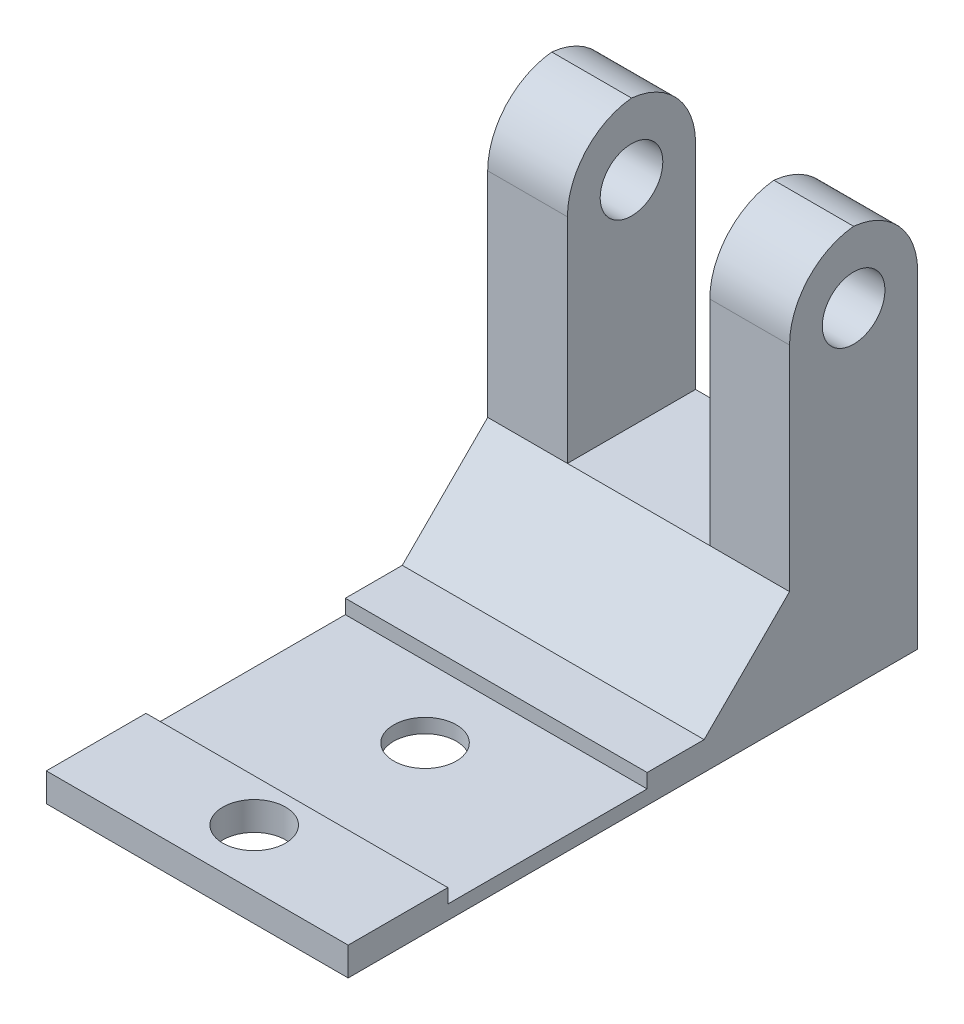
from build123d import *

# Parameters (mm, degrees)
SKETCH1_R           = 1.1
BOSS_EXTRUDE1_DEPTH = 1
SKETCH2_W           = 2.8
SKETCH2_H           = 5
BOSS_EXTRUDE2_DEPTH = 8
SKETCH4_W           = 2.8
SKETCH4_H           = 9
BOSS_EXTRUDE3_DEPTH = 3
SKETCH5_R           = 1.1
CUT_EXTRUDE2_DEPTH  = 100
SKETCH6_W           = 2.8
SKETCH6_H           = 8
BOSS_EXTRUDE4_DEPTH = 1
SKETCH7_W           = 3.5
SKETCH7_H           = 9
CUT_EXTRUDE3_DEPTH  = 100
CHAMFER2_SIZE       = 3
SKETCH8_W           = 10.6
SKETCH8_H           = 3
CUT_EXTRUDE4_DEPTH  = 10
BOSS_EXTRUDE5_DEPTH = 7.8
SKETCH10_W          = 10.6
SKETCH10_H          = 7
CUT_EXTRUDE5_DEPTH  = 0.5
SKETCH11_W          = 2.8
SKETCH11_H          = 4.5
BOSS_EXTRUDE6_DEPTH = 4
SKETCH12_R          = 1.1
BOSS_EXTRUDE7_DEPTH = 10.6
SKETCH13_W          = 5
SKETCH13_H          = 4.5
CUT_EXTRUDE6_DEPTH  = 10
SKETCH14_R          = 1.1
CUT_EXTRUDE7_DEPTH  = 20
FILLET1_R           = 2.5


with BuildPart() as part:
    # Sketch1 → Boss-Extrude1 (new body)
    with BuildSketch(Plane(origin=(0, 0, 0), x_dir=(1, 0, 0), z_dir=(0, 1, 0))):
        Polygon((-14.28, 13.79), (-14.28, -6.21), (-3.68, -6.21), (-3.68, 13.79), (-6.48, 13.79), (-6.48, 8.79), (-11.48, 8.79), (-11.48, 13.79), align=None)
        with Locations(Location((-8.98, 4.79, 0), (0, 0, 270))):
            Circle(SKETCH1_R, mode=Mode.SUBTRACT)
        with Locations(Location((-8.98, -1.21, 0), (0, 0, 270))):
            Circle(SKETCH1_R, mode=Mode.SUBTRACT)
    extrude(amount=BOSS_EXTRUDE1_DEPTH)

    # Sketch2 → Boss-Extrude2 (add)
    with BuildSketch(Plane(origin=(0, 1, 0), x_dir=(1, 0, 0), z_dir=(0, 1, 0))):
        with Locations((-12.88, 11.29)):
            Rectangle(SKETCH2_W, SKETCH2_H)
        with Locations((-5.08, 11.29)):
            Rectangle(SKETCH2_W, SKETCH2_H)
    extrude(amount=BOSS_EXTRUDE2_DEPTH)

    # Sketch4 → Boss-Extrude3 (add)
    with BuildSketch(Plane(origin=(0, 0, -13.79), x_dir=(-1, 0, 0), z_dir=(0, 0, -1))):
        with Locations((5.08, 4.5)):
            Rectangle(SKETCH4_W, SKETCH4_H)
        with Locations((12.88, 4.5)):
            Rectangle(SKETCH4_W, SKETCH4_H)
    extrude(amount=BOSS_EXTRUDE3_DEPTH)

    # Sketch5 → Cut-Extrude2 (cut)
    with BuildSketch(Plane(origin=(-3.68, 0, 0), x_dir=(0, 0, -1), z_dir=(1, 0, 0))):
        with Locations((14.29, 7.5)):
            Circle(SKETCH5_R)
    extrude(amount=-CUT_EXTRUDE2_DEPTH, mode=Mode.SUBTRACT)

    # Sketch6 → Boss-Extrude4 (add)
    with BuildSketch(Plane(origin=(0, 9, 0), x_dir=(1, 0, 0), z_dir=(0, 1, 0))):
        with Locations((-12.88, 12.79)):
            Rectangle(SKETCH6_W, SKETCH6_H)
        with Locations((-5.08, 12.79)):
            Rectangle(SKETCH6_W, SKETCH6_H)
    extrude(amount=BOSS_EXTRUDE4_DEPTH)

    # Sketch7 → Cut-Extrude3 (cut)
    with BuildSketch(Plane(origin=(-3.68, 0, 0), x_dir=(0, 0, -1), z_dir=(1, 0, 0))):
        with Locations((10.54, 5.5)):
            Rectangle(SKETCH7_W, SKETCH7_H)
    extrude(amount=-CUT_EXTRUDE3_DEPTH, mode=Mode.SUBTRACT)

    # Chamfer2
    chamfer2_edges = [part.edges().sort_by_distance(p)[0] for p in [
        (-5.08, 1, -12.29),
        (-12.88, 1, -12.29),
    ]]
    chamfer(chamfer2_edges, length=CHAMFER2_SIZE)

    # Sketch8 → Cut-Extrude4 (cut)
    with BuildSketch(Plane(origin=(0, 1, 0), x_dir=(1, 0, 0), z_dir=(0, 1, 0))):
        with Locations((-8.98, -4.71)):
            Rectangle(SKETCH8_W, SKETCH8_H)
    extrude(amount=-CUT_EXTRUDE4_DEPTH, mode=Mode.SUBTRACT)

    # Sketch9 → Boss-Extrude5 (add)
    with BuildSketch(Plane(origin=(-11.48, 0, 0), x_dir=(0, 0, -1), z_dir=(1, 0, 0))):
        Polygon((8.79, 1), (9.29, 1), (12.29, 4), (16.79, 4), (16.79, 0), (8.79, 0), align=None)
    extrude(amount=BOSS_EXTRUDE5_DEPTH)

    # Sketch10 → Cut-Extrude5 (cut)
    with BuildSketch(Plane(origin=(0, 1, 0), x_dir=(1, 0, 0), z_dir=(0, 1, 0))):
        with Locations((-8.98, 3.79)):
            Rectangle(SKETCH10_W, SKETCH10_H)
    extrude(amount=-CUT_EXTRUDE5_DEPTH, mode=Mode.SUBTRACT)

    # Sketch11 → Boss-Extrude6 (add)
    with BuildSketch(Plane(origin=(0, 10, 0), x_dir=(1, 0, 0), z_dir=(0, 1, 0))):
        with Locations((-12.88, 14.54)):
            Rectangle(SKETCH11_W, SKETCH11_H)
        with Locations((-5.08, 14.54)):
            Rectangle(SKETCH11_W, SKETCH11_H)
    extrude(amount=BOSS_EXTRUDE6_DEPTH)

    # Sketch12 → Boss-Extrude7 (add)
    with BuildSketch(Plane(origin=(-3.68, 0, 0), x_dir=(0, 0, -1), z_dir=(1, 0, 0))):
        with Locations((14.29, 7.5)):
            Circle(SKETCH12_R)
    extrude(amount=-BOSS_EXTRUDE7_DEPTH)

    # Sketch13 → Cut-Extrude6 (cut)
    with BuildSketch(Plane(origin=(0, 14, 0), x_dir=(1, 0, 0), z_dir=(0, 1, 0))):
        with Locations((-8.98, 14.54)):
            Rectangle(SKETCH13_W, SKETCH13_H)
    extrude(amount=-CUT_EXTRUDE6_DEPTH, mode=Mode.SUBTRACT)

    # Sketch14 → Cut-Extrude7 (cut)
    with BuildSketch(Plane(origin=(-3.68, 0, 0), x_dir=(0, 0, -1), z_dir=(1, 0, 0))):
        with Locations((14.54, 11.5)):
            Circle(SKETCH14_R)
    extrude(amount=-CUT_EXTRUDE7_DEPTH, mode=Mode.SUBTRACT)

    # Fillet1
    # the kernel refuses this fillet: 2.5 mm, written as the material it takes off along each edge
    with BuildSketch(Plane(origin=(-20.53, 14, -16.79), x_dir=(0, 0, 1), z_dir=(1, 0, 0)), Plane(origin=(-12.73, 14, -12.29), x_dir=(0, -1, 0), z_dir=(1, 0, 0)), Plane(origin=(2.57, 14, -16.79), x_dir=(0, -1, 0), z_dir=(-1, 0, 0))) as fillet1_piece_1:
        with BuildLine():
            CenterArc((FILLET1_R, FILLET1_R), FILLET1_R, 180, 90)
            Line((0, FILLET1_R), (0, 0))
            Line((0, 0), (FILLET1_R, 0))
        make_face()
    extrude(amount=15.3, mode=Mode.SUBTRACT)
    with BuildSketch(Plane(origin=(-5.23, 14, -12.29), x_dir=(0, -1, 0), z_dir=(-1, 0, 0))) as fillet1_piece_2:
        with BuildLine():
            CenterArc((FILLET1_R, -FILLET1_R), FILLET1_R, 90, 90)
            Line((0, -FILLET1_R), (0, 0))
            Line((0, 0), (FILLET1_R, 0))
        make_face()
    extrude(amount=15.3, mode=Mode.SUBTRACT)


solid = part.part
